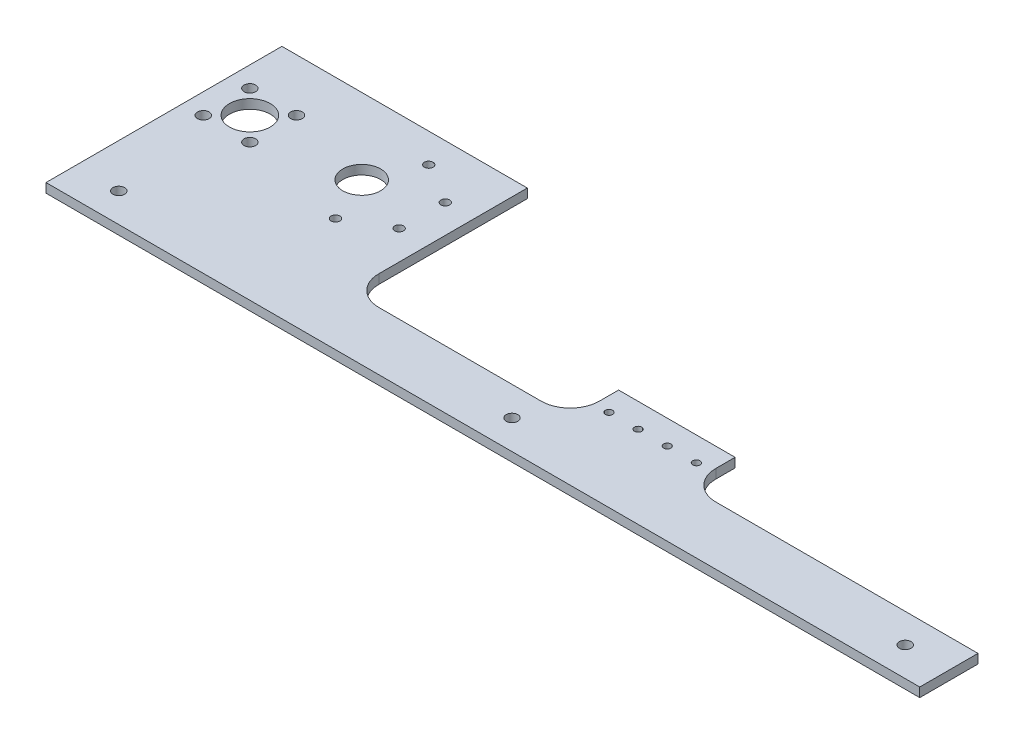
from build123d import *

# Parameters (mm, degrees)
SKETCH1_R           = 2
SKETCH1_R_2         = 7
SKETCH1_R_3         = 1.5
SKETCH1_R_4         = 1.25
BOSS_EXTRUDE1_DEPTH = 3.175
FILLET2_R           = 10
FILLET3_R           = 10
BOSS_EXTRUDE2_DEPTH = 3.175


with BuildPart() as part:
    # Sketch1 → Boss-Extrude1 (new body)
    with BuildSketch(Plane(origin=(0, 0, 0), x_dir=(1, 0, 0), z_dir=(0, 1, 0))):
        Polygon((230, 0), (230, 10), (230, 20), (200, 20), (200, 36.6), (195, 36.6), (160, 36.6), (160, 20), (84.256406461, 20), (84.256406461, 81), (0, 81), (0, 0), align=None)
        with Locations((15, 10)):
            Circle(SKETCH1_R, mode=Mode.SUBTRACT)
        with BuildLine():
            ThreePointArc((148, 10), (150, 12), (152, 10))
            ThreePointArc((152, 10), (150, 8), (148, 10))
        make_face(mode=Mode.SUBTRACT)
        with Locations((15, 55)):
            Circle(SKETCH1_R_2, mode=Mode.SUBTRACT)
        with Locations((7, 47)):
            Circle(SKETCH1_R, mode=Mode.SUBTRACT)
        with Locations((23, 47)):
            Circle(SKETCH1_R, mode=Mode.SUBTRACT)
        with Locations((7, 63)):
            Circle(SKETCH1_R, mode=Mode.SUBTRACT)
        with BuildLine():
            ThreePointArc((59.9, 55), (53.4, 48.5), (46.9, 55))
            ThreePointArc((46.9, 55), (53.4, 61.5), (59.9, 55))
        make_face(mode=Mode.SUBTRACT)
        with Locations((60.4, 39)):
            Circle(SKETCH1_R_3, mode=Mode.SUBTRACT)
        with Locations((74.256406461, 47)):
            Circle(SKETCH1_R_3, mode=Mode.SUBTRACT)
        with Locations((74.469853975, 62.618346876)):
            Circle(SKETCH1_R_3, mode=Mode.SUBTRACT)
        with Locations((60.4, 71)):
            Circle(SKETCH1_R_3, mode=Mode.SUBTRACT)
        with Locations((185, 28.3)):
            Circle(SKETCH1_R_4, mode=Mode.SUBTRACT)
        with Locations((165, 28.3)):
            Circle(SKETCH1_R_4, mode=Mode.SUBTRACT)
        with Locations((175, 28.3)):
            Circle(SKETCH1_R_4, mode=Mode.SUBTRACT)
        with Locations((195, 28.3)):
            Circle(SKETCH1_R_4, mode=Mode.SUBTRACT)
        with Locations((23, 63)):
            Circle(SKETCH1_R, mode=Mode.SUBTRACT)
    extrude(amount=BOSS_EXTRUDE1_DEPTH)

    # Fillet2
    fillet2_edges = [part.edges().sort_by_distance(p)[0] for p in [
        (84.256406461, 1.5875, -20),
    ]]
    fillet(fillet2_edges, radius=FILLET2_R)

    # Fillet3
    fillet3_edges = [part.edges().sort_by_distance(p)[0] for p in [
        (200, 1.5875, -20),
        (160, 1.5875, -20),
    ]]
    fillet(fillet3_edges, radius=FILLET3_R)

    # Sketch2 → Boss-Extrude2 (add)
    with BuildSketch(Plane.XZ):
        Polygon((230, -10), (230, -20), (300, -20), (300, 0), (230, 0), align=None)
        with BuildLine():
            ThreePointArc((287, -10), (285, -12), (283, -10))
            ThreePointArc((283, -10), (285, -8), (287, -10))
        make_face(mode=Mode.SUBTRACT)
    extrude(amount=-BOSS_EXTRUDE2_DEPTH)


solid = part.part
